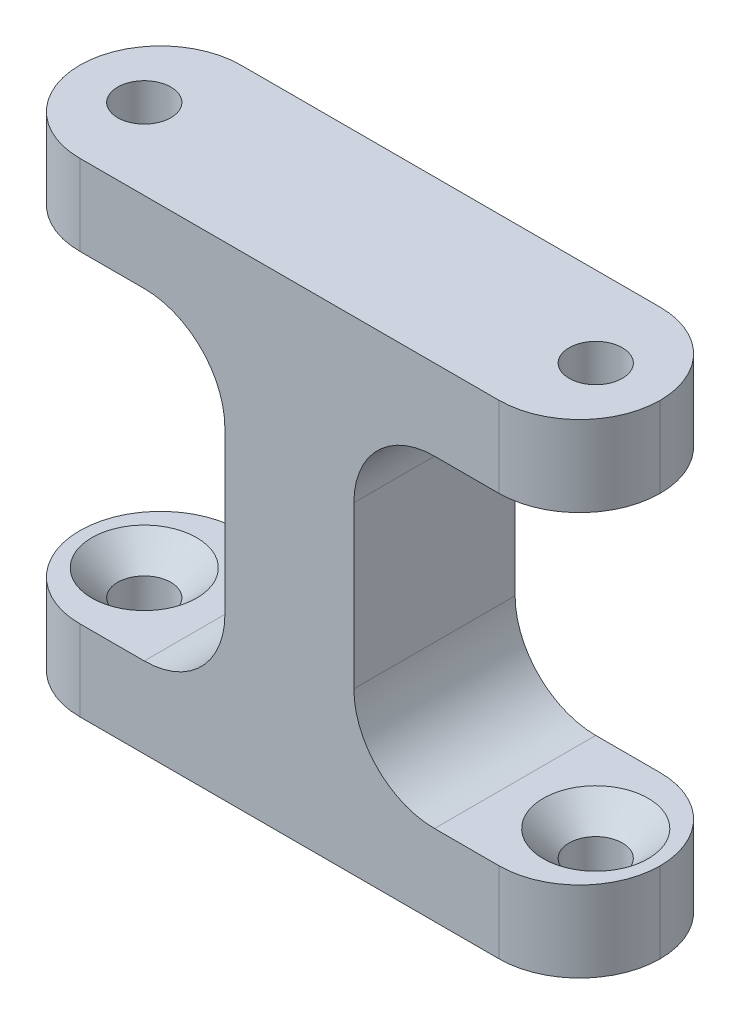
from build123d import *

# Parameters (mm, degrees)
BOSS_EXTRUDE1_DEPTH     = 10
CUT_EXTRUDE1_DEPTH      = 48.916594203
CUT_EXTRUDE1_DEPTH_BACK = 48.916594203
SKETCH2_R               = 1.65
CHAMFER1_SIZE           = 1.6
FILLET1_R               = 5
FILLET2_R               = 5


with BuildPart() as part:
    # Sketch1 → Boss-Extrude1 (new body)
    with BuildSketch(Plane.XY):
        Polygon((0, 0), (0, 5), (-14, 5), (-14, 25), (0, 25), (0, 30), (-36, 30), (-36, 25), (-22, 25), (-22, 5), (-36, 5), (-36, 0), align=None)
    extrude(amount=BOSS_EXTRUDE1_DEPTH)

    # Sketch2 → Cut-Extrude1 (cut, two sides: drawn at the far end of the back side and taken through both)
    with BuildSketch(Plane(origin=(0, 30, 0), x_dir=(1, 0, 0), z_dir=(0, 1, 0)).offset(-CUT_EXTRUDE1_DEPTH_BACK)):
        with Locations(Location((-32, -5, 0), (0, 0, 180))):
            Circle(SKETCH2_R)
        with Locations(Location((-4, -5, 0), (0, 0, 180))):
            Circle(SKETCH2_R)
    extrude(amount=CUT_EXTRUDE1_DEPTH + CUT_EXTRUDE1_DEPTH_BACK, mode=Mode.SUBTRACT)

    # Chamfer1
    chamfer1_edges = [part.edges().sort_by_distance(p)[0] for p in [
        (-30.35, 5, 5),
        (-2.35, 5, 5),
    ]]
    chamfer(chamfer1_edges, length=CHAMFER1_SIZE)

    # Fillet1
    fillet1_edges = [part.edges().sort_by_distance(p)[0] for p in [
        (-22, 5, 5),
        (-22, 25, 5),
        (-14, 25, 5),
        (-14, 5, 5),
    ]]
    fillet(fillet1_edges, radius=FILLET1_R)

    # Fillet2
    fillet2_edges = [part.edges().sort_by_distance(p)[0] for p in [
        (0, 27.5, 10),
        (0, 27.5, 0),
        (0, 2.5, 0),
        (0, 2.5, 10),
        (-36, 2.5, 0),
        (-36, 2.5, 10),
        (-36, 27.5, 0),
        (-36, 27.5, 10),
    ]]
    fillet(fillet2_edges, radius=FILLET2_R - 0.0001)  # a hair under: the kernel refuses the full size


solid = part.part
